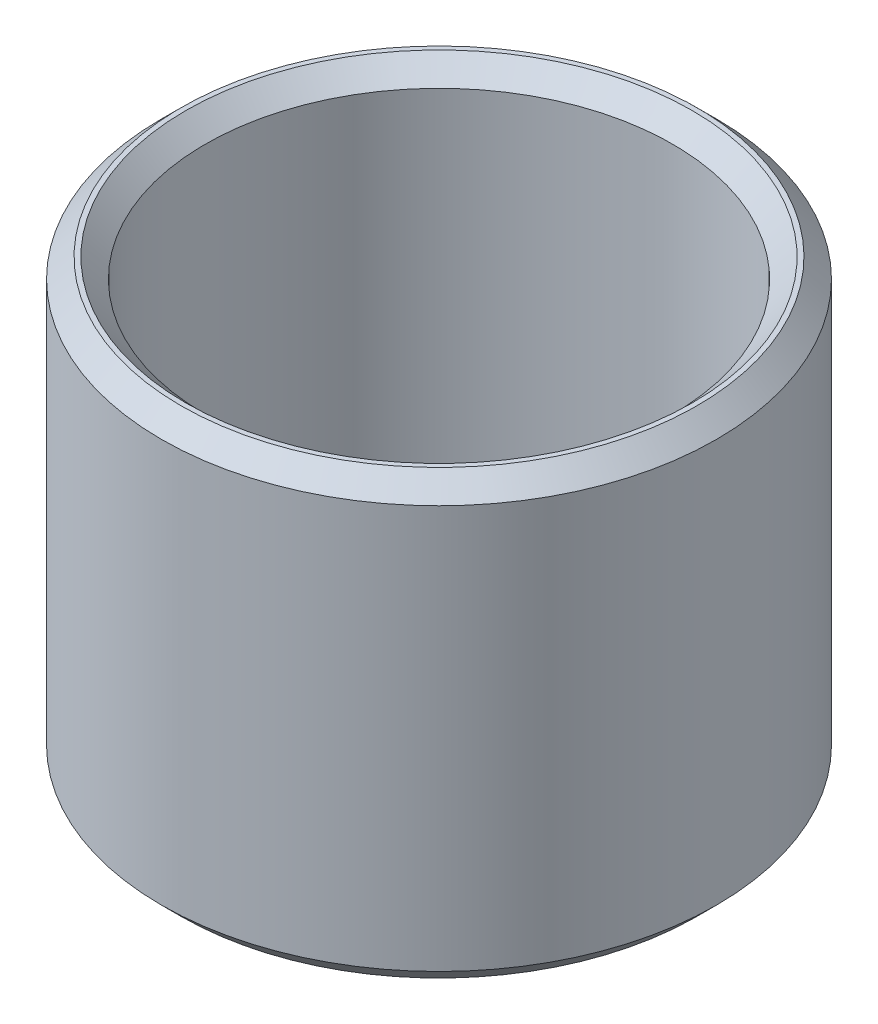
from build123d import *

# Parameters (mm, degrees)
SKETCH1_R           = 50
BOSS_EXTRUDE1_DEPTH = 79.669708476
SKETCH2_R           = 42.118733985
CUT_EXTRUDE1_DEPTH  = 107.523530023
CHAMFER1_SIZE       = 3.502861802


with BuildPart() as part:
    # Sketch1 → Boss-Extrude1 (new body)
    with BuildSketch(Plane(origin=(0, 0, 0), x_dir=(1, 0, 0), z_dir=(0, 1, 0))):
        Circle(SKETCH1_R)
    extrude(amount=BOSS_EXTRUDE1_DEPTH)

    # Sketch2 → Cut-Extrude1 (cut, through all)
    with BuildSketch(Plane(origin=(0, 0, 0), x_dir=(1, 0, 0), z_dir=(0, 1, 0))):
        Circle(SKETCH2_R)
    extrude(amount=CUT_EXTRUDE1_DEPTH, mode=Mode.SUBTRACT)

    # Chamfer1
    chamfer1_edges = [part.edges().sort_by_distance(p)[0] for p in [
        (-42.118733985, 79.669708476, 0),
        (-42.118733985, 0, 0),
        (-50, 0, 0),
        (-50, 79.669708476, 0),
    ]]
    chamfer(chamfer1_edges, length=CHAMFER1_SIZE)


solid = part.part
